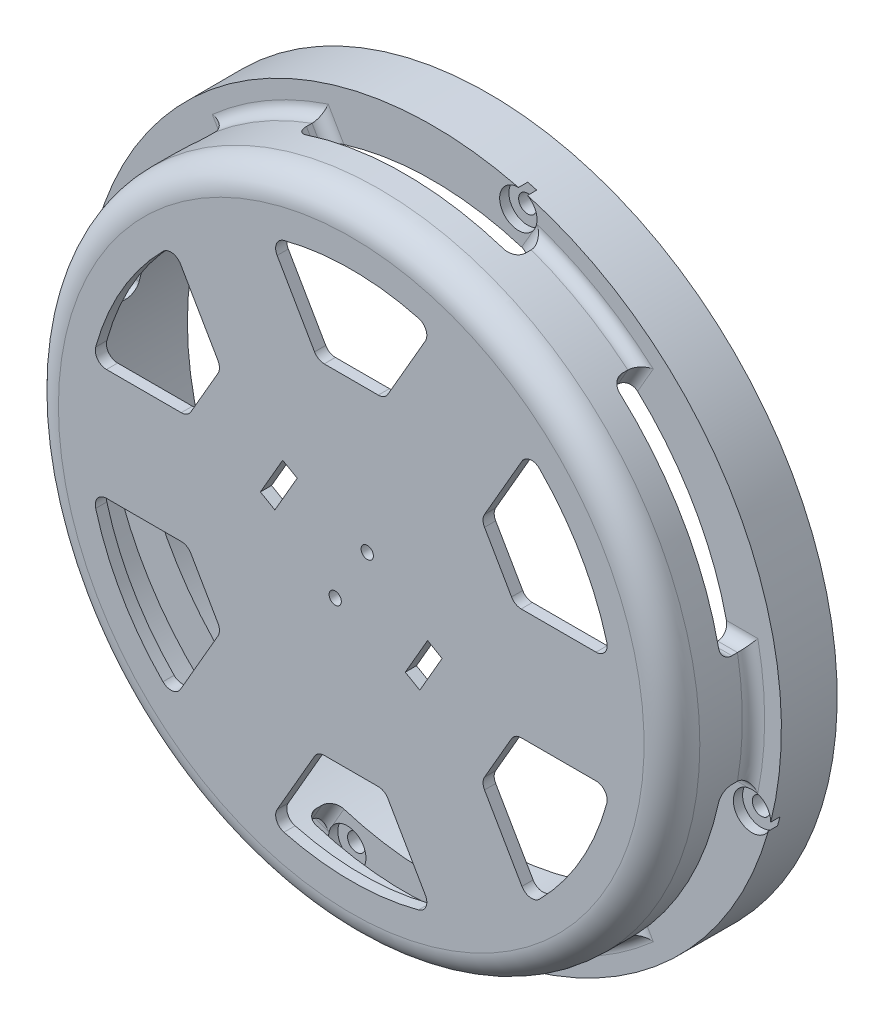
from build123d import *
from build123d.topology import SkipClean

# Parameters (mm, degrees)
SKETCH1_R                      = 62.5
SKETCH1_R_2                    = 54
BOSS_EXTRUDE1_DEPTH            = 10
SKETCH13_R                     = 1.1
CUT_EXTRUDE4_DEPTH             = 2
CUT_EXTRUDE5_REACH             = 153.648
CUT_EXTRUDE5_END_RADIUS        = 54
SKETCH14_W                     = 5
SKETCH14_H                     = 10
CUT_EXTRUDE8_START             = -14.625
CUT_EXTRUDE8_DEPTH             = 5
CBORE_FOR_M3_SBHCS1_AT_2_COUNT = 2
CBORE_FOR_M3_SBHCS1_AT_2_PITCH = 83.792153571
CBORE_FOR_M3_SBHCS1_AT_3_COUNT = 2
CBORE_FOR_M3_SBHCS1_AT_3_PITCH = 118.5
CBORE_FOR_M3_SBHCS1_AT_4_COUNT = 2
CBORE_FOR_M3_SBHCS1_AT_4_PITCH = 83.792153571
SKETCH18_R                     = 1.6
CUT_EXTRUDE7_DEPTH             = 5
CUT_EXTRUDE9_REACH             = 93.755
FILLET1_R                      = 2
FILLET2_R                      = 2
FILLET3_R                      = 2


with BuildPart() as part:
    # Sketch1 → Boss-Extrude1 (new body)
    with BuildSketch(Plane.XY):
        Circle(SKETCH1_R)
        Circle(SKETCH1_R_2, mode=Mode.SUBTRACT)
    extrude(amount=BOSS_EXTRUDE1_DEPTH)

    # Sketch19 → Revolve2 (revolve)
    with SkipClean():  # the faces are left unmerged after this step: merging them gives an invalid solid
        with BuildSketch(Plane(origin=(0, 0, 0), x_dir=(0, 0, -1), z_dir=(1, 0, 0)), mode=Mode.PRIVATE) as revolve2_sk:
            with BuildLine():
                Line((-10, 57.5), (-10, 54))
                Line((-10, 54), (-19.625, 54))
                ThreePointArc((-19.625, 54), (-21.746320344, 53.121320344), (-22.625, 51))
                Line((-22.625, 51), (-22.625, 0))
                Line((-22.625, 0), (-24.625, 0))
                Line((-24.625, 0), (-24.625, 52.5))
                ThreePointArc((-24.625, 52.5), (-23.160533906, 56.035533906), (-19.625, 57.5))
                Line((-19.625, 57.5), (-10, 57.5))
            make_face()
        revolve(revolve2_sk.sketch.rotate(Axis((0, 0, 0), (0, 0, 1)), 90), axis=Axis((0, 0, 0), (0, 0, 1)))
    add(part.part.scale(1), mode=Mode.REPLACE)  # the faces are merged on a copy

    # Sketch13 → Cut-Extrude4 (cut)
    with BuildSketch(Plane.XY.offset(24.625)):
        with Locations((-2.875, -4.979646072)):
            Circle(SKETCH13_R)
        with Locations((2.875, 4.979646072)):
            Circle(SKETCH13_R)
        Polygon((-16.289419162, 4.785898385), (-12.289419162, 11.714101615), (-9.691342951, 10.214101615), (-13.691342951, 3.285898385), align=None)
        Polygon((9.691342951, -10.214101615), (13.691342951, -3.285898385), (16.289419162, -4.785898385), (12.289419162, -11.714101615), align=None)
    extrude(amount=-CUT_EXTRUDE4_DEPTH, mode=Mode.SUBTRACT)

    # Cut-Extrude5: up to this cylinder (the profile starts outside it)
    cut_extrude5_end = Plane(origin=(0, 0, 2.5), z_dir=(0, 0, -1)) * Cylinder(CUT_EXTRUDE5_END_RADIUS, 416.296, mode=Mode.PRIVATE)
    # Sketch14 → Cut-Extrude5 (cut, up to the surface)
    with BuildSketch(Plane(origin=(-54.126587737, -31.25, 0), x_dir=(0, 0, -1), z_dir=(-0.8660254037844378, -0.5000000000000012, 0)), mode=Mode.PRIVATE) as cut_extrude5_sk1:
        with Locations((-2.5, 0)):
            Rectangle(SKETCH14_W, SKETCH14_H)
    cut_extrude5_tool1 = extrude(cut_extrude5_sk1.sketch, amount=-CUT_EXTRUDE5_REACH, mode=Mode.PRIVATE) - cut_extrude5_end
    add(cut_extrude5_tool1.solids().sort_by_distance((-54.126588, -31.25, 2.5))[0], mode=Mode.SUBTRACT)

    # Sketch20 → Cut-Extrude8 (cut)
    with BuildSketch(Plane.XY.offset(24.625).offset(CUT_EXTRUDE8_START)):
        Polygon((42.320508076, 53.301270189), (23.320508076, 20.392304845), (29.320508076, 10), (67.320508076, 10), align=None)
        Polygon((42.320508076, -53.301270189), (67.320508076, -10), (29.320508076, -10), (23.320508076, -20.392304845), align=None)
        Polygon((-25, -63.301270189), (25, -63.301270189), (6, -30.392304845), (-6, -30.392304845), align=None)
        Polygon((-67.320508076, -10), (-42.320508076, -53.301270189), (-23.320508076, -20.392304845), (-29.320508076, -10), align=None)
        Polygon((-42.320508076, 53.301270189), (-67.320508076, 10), (-29.320508076, 10), (-23.320508076, 20.392304845), align=None)
        Polygon((25, 63.301270189), (-25, 63.301270189), (-6, 30.392304845), (6, 30.392304845), align=None)
    extrude(amount=CUT_EXTRUDE8_DEPTH, mode=Mode.SUBTRACT)

    # Sketch17 → CBORE for M3 SBHCS1 (revolve, cut)
    with BuildSketch(Plane(origin=(15.335028422, 57.231105208, 10), x_dir=(0, -1, 0), z_dir=(1, 0, 0))):
        Polygon((0, 0), (0, 10), (1.6, 10), (1.6, 1.65), (3.35, 1.65), (3.35, 0), align=None)
    cbore_for_m3_sbhcs1 = revolve(axis=Axis((15.335028422, 57.231105208, 16.35), (0, 0, -1)), mode=Mode.SUBTRACT)

    # CBORE for M3 SBHCS1 at 2: CBORE for M3 SBHCS1 ×2
    with Locations(*[Vector(0.5000000000000046, -0.866025403784436, 0) * (i * CBORE_FOR_M3_SBHCS1_AT_2_PITCH) for i in range(1, CBORE_FOR_M3_SBHCS1_AT_2_COUNT)]):
        add(cbore_for_m3_sbhcs1, mode=Mode.SUBTRACT)

    # CBORE for M3 SBHCS1 at 3: CBORE for M3 SBHCS1 ×2
    with Locations(*[Vector(-0.258819045102516, -0.9659258262890695, 0) * (i * CBORE_FOR_M3_SBHCS1_AT_3_PITCH) for i in range(1, CBORE_FOR_M3_SBHCS1_AT_3_COUNT)]):
        add(cbore_for_m3_sbhcs1, mode=Mode.SUBTRACT)

    # CBORE for M3 SBHCS1 at 4: CBORE for M3 SBHCS1 ×2
    with Locations(*[Vector(-0.8660254037844362, -0.5000000000000043, 0) * (i * CBORE_FOR_M3_SBHCS1_AT_4_PITCH) for i in range(1, CBORE_FOR_M3_SBHCS1_AT_4_COUNT)]):
        add(cbore_for_m3_sbhcs1, mode=Mode.SUBTRACT)

    # Sketch18 → Cut-Extrude7 (cut)
    with BuildSketch(Plane(origin=(0, 0, 0), x_dir=(-1, 0, 0), z_dir=(0, 0, -1))):
        with Locations((-51.312005174, 29.625)):
            Circle(SKETCH18_R)
        with Locations((29.625, 51.312005174)):
            Circle(SKETCH18_R)
        with Locations((51.312005174, -29.625)):
            Circle(SKETCH18_R)
        with Locations((-29.625, -51.312005174)):
            Circle(SKETCH18_R)
    extrude(amount=-CUT_EXTRUDE7_DEPTH, mode=Mode.SUBTRACT)

    # Sketch21 → Cut-Extrude9 (cut, up to next)
    with BuildSketch(Plane.XY.offset(24.625), mode=Mode.PRIVATE) as cut_extrude9_sk1:
        with BuildLine():
            Line((46.435439053, -10), (29.320508076, -10))
            Line((29.320508076, -10), (23.320508076, -20.392304845))
            Line((23.320508076, -20.392304845), (31.877973564, -35.214269855))
            ThreePointArc((31.877973564, -35.214269855), (41.13620668, -23.75), (46.435439053, -10))
        make_face()
    cut_extrude9_tool1 = extrude(cut_extrude9_sk1.sketch, amount=-CUT_EXTRUDE9_REACH, mode=Mode.PRIVATE) & part.part
    # Sketch21 → Cut-Extrude9 (cut, up to next)
    with BuildSketch(Plane.XY.offset(24.625), mode=Mode.PRIVATE) as cut_extrude9_sk2:
        with BuildLine():
            Line((31.877973564, 35.214269855), (23.320508076, 20.392304845))
            Line((23.320508076, 20.392304845), (29.320508076, 10))
            Line((29.320508076, 10), (46.435439053, 10))
            ThreePointArc((46.435439053, 10), (41.13620668, 23.75), (31.877973564, 35.214269855))
        make_face()
    cut_extrude9_tool2 = extrude(cut_extrude9_sk2.sketch, amount=-CUT_EXTRUDE9_REACH, mode=Mode.PRIVATE) & part.part
    # Sketch21 → Cut-Extrude9 (cut, up to next)
    with BuildSketch(Plane.XY.offset(24.625), mode=Mode.PRIVATE) as cut_extrude9_sk3:
        with BuildLine():
            Line((-14.557465488, 45.214269855), (-6, 30.392304845))
            Line((-6, 30.392304845), (6, 30.392304845))
            Line((6, 30.392304845), (14.557465488, 45.214269855))
            ThreePointArc((14.557465488, 45.214269855), (0, 47.5), (-14.557465488, 45.214269855))
        make_face()
    cut_extrude9_tool3 = extrude(cut_extrude9_sk3.sketch, amount=-CUT_EXTRUDE9_REACH, mode=Mode.PRIVATE) & part.part
    # Sketch21 → Cut-Extrude9 (cut, up to next)
    with BuildSketch(Plane.XY.offset(24.625), mode=Mode.PRIVATE) as cut_extrude9_sk4:
        with BuildLine():
            Line((-46.435439053, 10), (-29.320508076, 10))
            Line((-29.320508076, 10), (-23.320508076, 20.392304845))
            Line((-23.320508076, 20.392304845), (-31.877973564, 35.214269855))
            ThreePointArc((-31.877973564, 35.214269855), (-41.13620668, 23.75), (-46.435439053, 10))
        make_face()
    cut_extrude9_tool4 = extrude(cut_extrude9_sk4.sketch, amount=-CUT_EXTRUDE9_REACH, mode=Mode.PRIVATE) & part.part
    # Sketch21 → Cut-Extrude9 (cut, up to next)
    with BuildSketch(Plane.XY.offset(24.625), mode=Mode.PRIVATE) as cut_extrude9_sk5:
        with BuildLine():
            Line((-31.877973564, -35.214269855), (-23.320508076, -20.392304845))
            Line((-23.320508076, -20.392304845), (-29.320508076, -10))
            Line((-29.320508076, -10), (-46.435439053, -10))
            ThreePointArc((-46.435439053, -10), (-41.13620668, -23.75), (-31.877973564, -35.214269855))
        make_face()
    cut_extrude9_tool5 = extrude(cut_extrude9_sk5.sketch, amount=-CUT_EXTRUDE9_REACH, mode=Mode.PRIVATE) & part.part
    # Sketch21 → Cut-Extrude9 (cut, up to next)
    with BuildSketch(Plane.XY.offset(24.625), mode=Mode.PRIVATE) as cut_extrude9_sk6:
        with BuildLine():
            Line((14.557465488, -45.214269855), (6, -30.392304845))
            Line((6, -30.392304845), (-6, -30.392304845))
            Line((-6, -30.392304845), (-14.557465488, -45.214269855))
            ThreePointArc((-14.557465488, -45.214269855), (0, -47.5), (14.557465488, -45.214269855))
        make_face()
    cut_extrude9_tool6 = extrude(cut_extrude9_sk6.sketch, amount=-CUT_EXTRUDE9_REACH, mode=Mode.PRIVATE) & part.part
    add(cut_extrude9_tool1.solids().sort_by_distance((34.435994, -19.88163, 24.625))[0], mode=Mode.SUBTRACT)
    add(cut_extrude9_tool2.solids().sort_by_distance((34.435994, 19.88163, 24.625))[0], mode=Mode.SUBTRACT)
    add(cut_extrude9_tool3.solids().sort_by_distance((0, 39.76326, 24.625))[0], mode=Mode.SUBTRACT)
    add(cut_extrude9_tool4.solids().sort_by_distance((-34.435994, 19.88163, 24.625))[0], mode=Mode.SUBTRACT)
    add(cut_extrude9_tool5.solids().sort_by_distance((-34.435994, -19.88163, 24.625))[0], mode=Mode.SUBTRACT)
    add(cut_extrude9_tool6.solids().sort_by_distance((0, -39.76326, 24.625))[0], mode=Mode.SUBTRACT)

    # Fillet1
    # the kernel refuses this fillet: 2 mm, written as the material it adds along each edge
    with BuildSketch(Plane(origin=(-32.693252361, 36.626374153, 10), x_dir=(-0.866025403784439, -0.49999999999999933, 0), z_dir=(-0.49999999999999933, 0.866025403784439, 0))) as fillet1_piece_1_section:
        with BuildLine():
            CenterArc((FILLET1_R, FILLET1_R), FILLET1_R, 180, 90)
            Line((0, FILLET1_R), (0, 0))
            Line((0, 0), (FILLET1_R, 0))
        make_face()
    fillet1_piece_1 = extrude(amount=13.557761619, mode=Mode.PRIVATE)
    fillet1_piece_1 = fillet1_piece_1 - Plane(origin=(0, 0, 10), x_dir=(1, 0, 0), z_dir=(0, 0, -1)) * Cylinder(54, 36, mode=Mode.PRIVATE)
    fillet1_piece_1 = fillet1_piece_1 & Plane(origin=(0, 0, 10), x_dir=(-1, 0, 0), z_dir=(0, 0, -1)) * Cylinder(57.5, 36, mode=Mode.PRIVATE)
    with BuildSketch(Plane(origin=(-61.623758265, 10, 10), x_dir=(0, 1, 0), z_dir=(1, 0, 0))) as fillet1_piece_2_section:
        with BuildLine():
            CenterArc((FILLET1_R, FILLET1_R), FILLET1_R, 180, 90)
            Line((0, FILLET1_R), (0, 0))
            Line((0, 0), (FILLET1_R, 0))
        make_face()
    fillet1_piece_2 = extrude(amount=13.557761619, mode=Mode.PRIVATE)
    fillet1_piece_2 = fillet1_piece_2 - Plane(origin=(0, 0, 10), x_dir=(1, 0, 0), z_dir=(0, 0, -1)) * Cylinder(54, 36, mode=Mode.PRIVATE)
    fillet1_piece_2 = fillet1_piece_2 & Plane(origin=(0, 0, 10), x_dir=(-1, 0, 0), z_dir=(0, 0, -1)) * Cylinder(57.5, 36, mode=Mode.PRIVATE)
    with BuildSketch(Plane(origin=(-32.693252361, 36.626374153, 15), x_dir=(0, 0, -1), z_dir=(-0.49999999999999933, 0.866025403784439, 0))) as fillet1_piece_3_section:
        with BuildLine():
            CenterArc((FILLET1_R, FILLET1_R), FILLET1_R, 180, 90)
            Line((0, FILLET1_R), (0, 0))
            Line((0, 0), (FILLET1_R, 0))
        make_face()
    fillet1_piece_3 = extrude(amount=13.557761619, mode=Mode.PRIVATE)
    fillet1_piece_3 = fillet1_piece_3 & Plane(origin=(0, 0, 15), x_dir=(-1, 0, 0), z_dir=(0, 0, -1)) * Cylinder(57.5, 36, mode=Mode.PRIVATE)
    fillet1_piece_3 = fillet1_piece_3 - Plane(origin=(0, 0, 15), x_dir=(-1, 0, 0), z_dir=(0, 0, 1)) * Cylinder(54, 36, mode=Mode.PRIVATE)
    with BuildSketch(Plane(origin=(-61.623758265, 10, 15), x_dir=(0, 0, -1), z_dir=(1, 0, 0))) as fillet1_piece_4_section:
        with BuildLine():
            CenterArc((FILLET1_R, FILLET1_R), FILLET1_R, 180, 90)
            Line((0, FILLET1_R), (0, 0))
            Line((0, 0), (FILLET1_R, 0))
        make_face()
    fillet1_piece_4 = extrude(amount=13.557761619, mode=Mode.PRIVATE)
    fillet1_piece_4 = fillet1_piece_4 & Plane(origin=(0, 0, 15), x_dir=(-1, 0, 0), z_dir=(0, 0, -1)) * Cylinder(57.5, 36, mode=Mode.PRIVATE)
    fillet1_piece_4 = fillet1_piece_4 - Plane(origin=(0, 0, 15), x_dir=(-1, 0, 0), z_dir=(0, 0, 1)) * Cylinder(54, 36, mode=Mode.PRIVATE)
    with BuildSketch(Plane(origin=(-48.065996646, -10, 10), x_dir=(0, -1, 0), z_dir=(-1, 0, 0))) as fillet1_piece_5_section:
        with BuildLine():
            CenterArc((FILLET1_R, FILLET1_R), FILLET1_R, 180, 90)
            Line((0, FILLET1_R), (0, 0))
            Line((0, 0), (FILLET1_R, 0))
        make_face()
    fillet1_piece_5 = extrude(amount=13.557761619, mode=Mode.PRIVATE)
    fillet1_piece_5 = fillet1_piece_5 - Plane(origin=(0, 0, 10), x_dir=(1, 0, 0), z_dir=(0, 0, -1)) * Cylinder(54, 36, mode=Mode.PRIVATE)
    fillet1_piece_5 = fillet1_piece_5 & Plane(origin=(0, 0, 10), x_dir=(-1, 0, 0), z_dir=(0, 0, -1)) * Cylinder(57.5, 36, mode=Mode.PRIVATE)
    with BuildSketch(Plane(origin=(-39.47213317, -48.367740134, 10), x_dir=(-0.8660254037844399, 0.4999999999999979, 0), z_dir=(0.4999999999999979, 0.8660254037844399, 0))) as fillet1_piece_6_section:
        with BuildLine():
            CenterArc((FILLET1_R, FILLET1_R), FILLET1_R, 180, 90)
            Line((0, FILLET1_R), (0, 0))
            Line((0, 0), (FILLET1_R, 0))
        make_face()
    fillet1_piece_6 = extrude(amount=13.557761619, mode=Mode.PRIVATE)
    fillet1_piece_6 = fillet1_piece_6 - Plane(origin=(0, 0, 10), x_dir=(1, 0, 0), z_dir=(0, 0, -1)) * Cylinder(54, 36, mode=Mode.PRIVATE)
    fillet1_piece_6 = fillet1_piece_6 & Plane(origin=(0, 0, 10), x_dir=(-1, 0, 0), z_dir=(0, 0, -1)) * Cylinder(57.5, 36, mode=Mode.PRIVATE)
    with BuildSketch(Plane(origin=(-48.065996646, -10, 15), x_dir=(0, 0, -1), z_dir=(-1, 0, 0))) as fillet1_piece_7_section:
        with BuildLine():
            CenterArc((FILLET1_R, FILLET1_R), FILLET1_R, 180, 90)
            Line((0, FILLET1_R), (0, 0))
            Line((0, 0), (FILLET1_R, 0))
        make_face()
    fillet1_piece_7 = extrude(amount=13.557761619, mode=Mode.PRIVATE)
    fillet1_piece_7 = fillet1_piece_7 & Plane(origin=(0, 0, 15), x_dir=(-1, 0, 0), z_dir=(0, 0, -1)) * Cylinder(57.5, 36, mode=Mode.PRIVATE)
    fillet1_piece_7 = fillet1_piece_7 - Plane(origin=(0, 0, 15), x_dir=(-1, 0, 0), z_dir=(0, 0, 1)) * Cylinder(54, 36, mode=Mode.PRIVATE)
    with BuildSketch(Plane(origin=(-39.47213317, -48.367740134, 15), x_dir=(0, 0, -1), z_dir=(0.4999999999999979, 0.8660254037844399, 0))) as fillet1_piece_8_section:
        with BuildLine():
            CenterArc((FILLET1_R, FILLET1_R), FILLET1_R, 180, 90)
            Line((0, FILLET1_R), (0, 0))
            Line((0, 0), (FILLET1_R, 0))
        make_face()
    fillet1_piece_8 = extrude(amount=13.557761619, mode=Mode.PRIVATE)
    fillet1_piece_8 = fillet1_piece_8 & Plane(origin=(0, 0, 15), x_dir=(-1, 0, 0), z_dir=(0, 0, -1)) * Cylinder(57.5, 36, mode=Mode.PRIVATE)
    fillet1_piece_8 = fillet1_piece_8 - Plane(origin=(0, 0, 15), x_dir=(-1, 0, 0), z_dir=(0, 0, 1)) * Cylinder(54, 36, mode=Mode.PRIVATE)
    with BuildSketch(Plane(origin=(32.693252361, -36.626374153, 10), x_dir=(0.8660254037844393, 0.4999999999999989, 0), z_dir=(0.4999999999999989, -0.8660254037844394, 0))) as fillet1_piece_9_section:
        with BuildLine():
            CenterArc((FILLET1_R, FILLET1_R), FILLET1_R, 180, 90)
            Line((0, FILLET1_R), (0, 0))
            Line((0, 0), (FILLET1_R, 0))
        make_face()
    fillet1_piece_9 = extrude(amount=13.557761619, mode=Mode.PRIVATE)
    fillet1_piece_9 = fillet1_piece_9 - Plane(origin=(0, 0, 10), x_dir=(1, 0, 0), z_dir=(0, 0, -1)) * Cylinder(54, 36, mode=Mode.PRIVATE)
    fillet1_piece_9 = fillet1_piece_9 & Plane(origin=(0, 0, 10), x_dir=(-1, 0, 0), z_dir=(0, 0, -1)) * Cylinder(57.5, 36, mode=Mode.PRIVATE)
    with BuildSketch(Plane(origin=(61.623758265, -10, 10), x_dir=(0, -1, 0), z_dir=(-1, 0, 0))) as fillet1_piece_10_section:
        with BuildLine():
            CenterArc((FILLET1_R, FILLET1_R), FILLET1_R, 180, 90)
            Line((0, FILLET1_R), (0, 0))
            Line((0, 0), (FILLET1_R, 0))
        make_face()
    fillet1_piece_10 = extrude(amount=13.557761619, mode=Mode.PRIVATE)
    fillet1_piece_10 = fillet1_piece_10 - Plane(origin=(0, 0, 10), x_dir=(1, 0, 0), z_dir=(0, 0, -1)) * Cylinder(54, 36, mode=Mode.PRIVATE)
    fillet1_piece_10 = fillet1_piece_10 & Plane(origin=(0, 0, 10), x_dir=(-1, 0, 0), z_dir=(0, 0, -1)) * Cylinder(57.5, 36, mode=Mode.PRIVATE)
    with BuildSketch(Plane(origin=(32.693252361, -36.626374153, 15), x_dir=(0, 0, -1), z_dir=(0.4999999999999989, -0.8660254037844394, 0))) as fillet1_piece_11_section:
        with BuildLine():
            CenterArc((FILLET1_R, FILLET1_R), FILLET1_R, 180, 90)
            Line((0, FILLET1_R), (0, 0))
            Line((0, 0), (FILLET1_R, 0))
        make_face()
    fillet1_piece_11 = extrude(amount=13.557761619, mode=Mode.PRIVATE)
    fillet1_piece_11 = fillet1_piece_11 & Plane(origin=(0, 0, 15), x_dir=(-1, 0, 0), z_dir=(0, 0, -1)) * Cylinder(57.5, 36, mode=Mode.PRIVATE)
    fillet1_piece_11 = fillet1_piece_11 - Plane(origin=(0, 0, 15), x_dir=(-1, 0, 0), z_dir=(0, 0, 1)) * Cylinder(54, 36, mode=Mode.PRIVATE)
    with BuildSketch(Plane(origin=(61.623758265, -10, 15), x_dir=(0, 0, -1), z_dir=(-1, 0, 0))) as fillet1_piece_12_section:
        with BuildLine():
            CenterArc((FILLET1_R, FILLET1_R), FILLET1_R, 180, 90)
            Line((0, FILLET1_R), (0, 0))
            Line((0, 0), (FILLET1_R, 0))
        make_face()
    fillet1_piece_12 = extrude(amount=13.557761619, mode=Mode.PRIVATE)
    fillet1_piece_12 = fillet1_piece_12 & Plane(origin=(0, 0, 15), x_dir=(-1, 0, 0), z_dir=(0, 0, -1)) * Cylinder(57.5, 36, mode=Mode.PRIVATE)
    fillet1_piece_12 = fillet1_piece_12 - Plane(origin=(0, 0, 15), x_dir=(-1, 0, 0), z_dir=(0, 0, 1)) * Cylinder(54, 36, mode=Mode.PRIVATE)
    with BuildSketch(Plane(origin=(-15.372744285, -46.626374153, 10), x_dir=(0.8660254037844383, -0.5000000000000009, 0), z_dir=(-0.5000000000000009, -0.8660254037844383, 0))) as fillet1_piece_13_section:
        with BuildLine():
            CenterArc((FILLET1_R, FILLET1_R), FILLET1_R, 180, 90)
            Line((0, FILLET1_R), (0, 0))
            Line((0, 0), (FILLET1_R, 0))
        make_face()
    fillet1_piece_13 = extrude(amount=13.557761619, mode=Mode.PRIVATE)
    fillet1_piece_13 = fillet1_piece_13 - Plane(origin=(0, 0, 10), x_dir=(1, 0, 0), z_dir=(0, 0, -1)) * Cylinder(54, 36, mode=Mode.PRIVATE)
    fillet1_piece_13 = fillet1_piece_13 & Plane(origin=(0, 0, 10), x_dir=(-1, 0, 0), z_dir=(0, 0, -1)) * Cylinder(57.5, 36, mode=Mode.PRIVATE)
    with BuildSketch(Plane(origin=(22.151625094, -58.367740134, 10), x_dir=(-0.8660254037844373, -0.5000000000000022, 0), z_dir=(-0.5000000000000023, 0.8660254037844374, 0))) as fillet1_piece_14_section:
        with BuildLine():
            CenterArc((FILLET1_R, FILLET1_R), FILLET1_R, 180, 90)
            Line((0, FILLET1_R), (0, 0))
            Line((0, 0), (FILLET1_R, 0))
        make_face()
    fillet1_piece_14 = extrude(amount=13.557761619, mode=Mode.PRIVATE)
    fillet1_piece_14 = fillet1_piece_14 - Plane(origin=(0, 0, 10), x_dir=(1, 0, 0), z_dir=(0, 0, -1)) * Cylinder(54, 36, mode=Mode.PRIVATE)
    fillet1_piece_14 = fillet1_piece_14 & Plane(origin=(0, 0, 10), x_dir=(-1, 0, 0), z_dir=(0, 0, -1)) * Cylinder(57.5, 36, mode=Mode.PRIVATE)
    with BuildSketch(Plane(origin=(-15.372744285, -46.626374153, 15), x_dir=(0, 0, -1), z_dir=(-0.5000000000000009, -0.8660254037844383, 0))) as fillet1_piece_15_section:
        with BuildLine():
            CenterArc((FILLET1_R, FILLET1_R), FILLET1_R, 180, 90)
            Line((0, FILLET1_R), (0, 0))
            Line((0, 0), (FILLET1_R, 0))
        make_face()
    fillet1_piece_15 = extrude(amount=13.557761619, mode=Mode.PRIVATE)
    fillet1_piece_15 = fillet1_piece_15 & Plane(origin=(0, 0, 15), x_dir=(-1, 0, 0), z_dir=(0, 0, -1)) * Cylinder(57.5, 36, mode=Mode.PRIVATE)
    fillet1_piece_15 = fillet1_piece_15 - Plane(origin=(0, 0, 15), x_dir=(-1, 0, 0), z_dir=(0, 0, 1)) * Cylinder(54, 36, mode=Mode.PRIVATE)
    with BuildSketch(Plane(origin=(22.151625094, -58.367740134, 15), x_dir=(0, 0, -1), z_dir=(-0.5000000000000023, 0.8660254037844374, 0))) as fillet1_piece_16_section:
        with BuildLine():
            CenterArc((FILLET1_R, FILLET1_R), FILLET1_R, 180, 90)
            Line((0, FILLET1_R), (0, 0))
            Line((0, 0), (FILLET1_R, 0))
        make_face()
    fillet1_piece_16 = extrude(amount=13.557761619, mode=Mode.PRIVATE)
    fillet1_piece_16 = fillet1_piece_16 & Plane(origin=(0, 0, 15), x_dir=(-1, 0, 0), z_dir=(0, 0, -1)) * Cylinder(57.5, 36, mode=Mode.PRIVATE)
    fillet1_piece_16 = fillet1_piece_16 - Plane(origin=(0, 0, 15), x_dir=(-1, 0, 0), z_dir=(0, 0, 1)) * Cylinder(54, 36, mode=Mode.PRIVATE)
    with BuildSketch(Plane(origin=(15.372744285, 46.626374153, 10), x_dir=(-0.8660254037844384, 0.5000000000000004, 0), z_dir=(0.5000000000000004, 0.8660254037844384, 0))) as fillet1_piece_17_section:
        with BuildLine():
            CenterArc((FILLET1_R, FILLET1_R), FILLET1_R, 180, 90)
            Line((0, FILLET1_R), (0, 0))
            Line((0, 0), (FILLET1_R, 0))
        make_face()
    fillet1_piece_17 = extrude(amount=13.557761619, mode=Mode.PRIVATE)
    fillet1_piece_17 = fillet1_piece_17 - Plane(origin=(0, 0, 10), x_dir=(1, 0, 0), z_dir=(0, 0, -1)) * Cylinder(54, 36, mode=Mode.PRIVATE)
    fillet1_piece_17 = fillet1_piece_17 & Plane(origin=(0, 0, 10), x_dir=(-1, 0, 0), z_dir=(0, 0, -1)) * Cylinder(57.5, 36, mode=Mode.PRIVATE)
    with BuildSketch(Plane(origin=(-22.151625094, 58.367740134, 10), x_dir=(0.8660254037844373, 0.5000000000000027, 0), z_dir=(0.5000000000000027, -0.8660254037844372, 0))) as fillet1_piece_18_section:
        with BuildLine():
            CenterArc((FILLET1_R, FILLET1_R), FILLET1_R, 180, 90)
            Line((0, FILLET1_R), (0, 0))
            Line((0, 0), (FILLET1_R, 0))
        make_face()
    fillet1_piece_18 = extrude(amount=13.557761619, mode=Mode.PRIVATE)
    fillet1_piece_18 = fillet1_piece_18 - Plane(origin=(0, 0, 10), x_dir=(1, 0, 0), z_dir=(0, 0, -1)) * Cylinder(54, 36, mode=Mode.PRIVATE)
    fillet1_piece_18 = fillet1_piece_18 & Plane(origin=(0, 0, 10), x_dir=(-1, 0, 0), z_dir=(0, 0, -1)) * Cylinder(57.5, 36, mode=Mode.PRIVATE)
    with BuildSketch(Plane(origin=(15.372744285, 46.626374153, 15), x_dir=(0, 0, -1), z_dir=(0.5000000000000004, 0.8660254037844384, 0))) as fillet1_piece_19_section:
        with BuildLine():
            CenterArc((FILLET1_R, FILLET1_R), FILLET1_R, 180, 90)
            Line((0, FILLET1_R), (0, 0))
            Line((0, 0), (FILLET1_R, 0))
        make_face()
    fillet1_piece_19 = extrude(amount=13.557761619, mode=Mode.PRIVATE)
    fillet1_piece_19 = fillet1_piece_19 & Plane(origin=(0, 0, 15), x_dir=(-1, 0, 0), z_dir=(0, 0, -1)) * Cylinder(57.5, 36, mode=Mode.PRIVATE)
    fillet1_piece_19 = fillet1_piece_19 - Plane(origin=(0, 0, 15), x_dir=(-1, 0, 0), z_dir=(0, 0, 1)) * Cylinder(54, 36, mode=Mode.PRIVATE)
    with BuildSketch(Plane(origin=(-22.151625094, 58.367740134, 15), x_dir=(0, 0, -1), z_dir=(0.5000000000000027, -0.8660254037844372, 0))) as fillet1_piece_20_section:
        with BuildLine():
            CenterArc((FILLET1_R, FILLET1_R), FILLET1_R, 180, 90)
            Line((0, FILLET1_R), (0, 0))
            Line((0, 0), (FILLET1_R, 0))
        make_face()
    fillet1_piece_20 = extrude(amount=13.557761619, mode=Mode.PRIVATE)
    fillet1_piece_20 = fillet1_piece_20 & Plane(origin=(0, 0, 15), x_dir=(-1, 0, 0), z_dir=(0, 0, -1)) * Cylinder(57.5, 36, mode=Mode.PRIVATE)
    fillet1_piece_20 = fillet1_piece_20 - Plane(origin=(0, 0, 15), x_dir=(-1, 0, 0), z_dir=(0, 0, 1)) * Cylinder(54, 36, mode=Mode.PRIVATE)
    with BuildSketch(Plane(origin=(48.065996646, 10, 10), x_dir=(0, 1, 0), z_dir=(1, 0, 0))) as fillet1_piece_21_section:
        with BuildLine():
            CenterArc((FILLET1_R, FILLET1_R), FILLET1_R, 180, 90)
            Line((0, FILLET1_R), (0, 0))
            Line((0, 0), (FILLET1_R, 0))
        make_face()
    fillet1_piece_21 = extrude(amount=13.557761619, mode=Mode.PRIVATE)
    fillet1_piece_21 = fillet1_piece_21 - Plane(origin=(0, 0, 10), x_dir=(1, 0, 0), z_dir=(0, 0, -1)) * Cylinder(54, 36, mode=Mode.PRIVATE)
    fillet1_piece_21 = fillet1_piece_21 & Plane(origin=(0, 0, 10), x_dir=(-1, 0, 0), z_dir=(0, 0, -1)) * Cylinder(57.5, 36, mode=Mode.PRIVATE)
    with BuildSketch(Plane(origin=(39.47213317, 48.367740134, 10), x_dir=(0.8660254037844398, -0.499999999999998, 0), z_dir=(-0.49999999999999795, -0.8660254037844398, 0))) as fillet1_piece_22_section:
        with BuildLine():
            CenterArc((FILLET1_R, FILLET1_R), FILLET1_R, 180, 90)
            Line((0, FILLET1_R), (0, 0))
            Line((0, 0), (FILLET1_R, 0))
        make_face()
    fillet1_piece_22 = extrude(amount=13.557761619, mode=Mode.PRIVATE)
    fillet1_piece_22 = fillet1_piece_22 - Plane(origin=(0, 0, 10), x_dir=(1, 0, 0), z_dir=(0, 0, -1)) * Cylinder(54, 36, mode=Mode.PRIVATE)
    fillet1_piece_22 = fillet1_piece_22 & Plane(origin=(0, 0, 10), x_dir=(-1, 0, 0), z_dir=(0, 0, -1)) * Cylinder(57.5, 36, mode=Mode.PRIVATE)
    with BuildSketch(Plane(origin=(48.065996646, 10, 15), x_dir=(0, 0, -1), z_dir=(1, 0, 0))) as fillet1_piece_23_section:
        with BuildLine():
            CenterArc((FILLET1_R, FILLET1_R), FILLET1_R, 180, 90)
            Line((0, FILLET1_R), (0, 0))
            Line((0, 0), (FILLET1_R, 0))
        make_face()
    fillet1_piece_23 = extrude(amount=13.557761619, mode=Mode.PRIVATE)
    fillet1_piece_23 = fillet1_piece_23 & Plane(origin=(0, 0, 15), x_dir=(-1, 0, 0), z_dir=(0, 0, -1)) * Cylinder(57.5, 36, mode=Mode.PRIVATE)
    fillet1_piece_23 = fillet1_piece_23 - Plane(origin=(0, 0, 15), x_dir=(-1, 0, 0), z_dir=(0, 0, 1)) * Cylinder(54, 36, mode=Mode.PRIVATE)
    with BuildSketch(Plane(origin=(39.47213317, 48.367740134, 15), x_dir=(0, 0, -1), z_dir=(-0.49999999999999795, -0.8660254037844398, 0))) as fillet1_piece_24_section:
        with BuildLine():
            CenterArc((FILLET1_R, FILLET1_R), FILLET1_R, 180, 90)
            Line((0, FILLET1_R), (0, 0))
            Line((0, 0), (FILLET1_R, 0))
        make_face()
    fillet1_piece_24 = extrude(amount=13.557761619, mode=Mode.PRIVATE)
    fillet1_piece_24 = fillet1_piece_24 & Plane(origin=(0, 0, 15), x_dir=(-1, 0, 0), z_dir=(0, 0, -1)) * Cylinder(57.5, 36, mode=Mode.PRIVATE)
    fillet1_piece_24 = fillet1_piece_24 - Plane(origin=(0, 0, 15), x_dir=(-1, 0, 0), z_dir=(0, 0, 1)) * Cylinder(54, 36, mode=Mode.PRIVATE)
    with BuildSketch(Plane(origin=(0, 0, 10), x_dir=(0.7070790246972205, 0.7071345365863752, 0), z_dir=(0.7071345365863752, -0.7070790246972205, 0))) as fillet1_piece_25_section:
        with BuildLine():
            CenterArc((57.5 + FILLET1_R, FILLET1_R), FILLET1_R, 180, 90)
            Line((57.5, FILLET1_R), (57.5, 0))
            Line((57.5, 0), (57.5 + FILLET1_R, 0))
        make_face()
    fillet1_piece_25 = revolve(axis=Axis((0, 0, 10), (0, 0, 1)), revolution_arc=29.995501957, mode=Mode.PRIVATE)
    fillet1_piece_25 = split(fillet1_piece_25, bisect_by=Plane(origin=(8.660254038, -5, 10), z_dir=(-0.8660254037844398, 0.49999999999999795, 0)), keep=Keep.TOP, mode=Mode.PRIVATE)
    fillet1_piece_25 = split(fillet1_piece_25, bisect_by=Plane(origin=(-8.660254038, 5, 10), z_dir=(0.8660254037844384, -0.5000000000000004, 0)), keep=Keep.TOP, mode=Mode.PRIVATE)
    with BuildSketch(Plane(origin=(0, 0, 10), x_dir=(-0.2588569602285776, 0.9659156661640914, 0), z_dir=(0.9659156661640914, 0.2588569602285776, 0))) as fillet1_piece_26_section:
        with BuildLine():
            CenterArc((57.5 + FILLET1_R, FILLET1_R), FILLET1_R, 180, 90)
            Line((57.5, FILLET1_R), (57.5, 0))
            Line((57.5, 0), (57.5 + FILLET1_R, 0))
        make_face()
    fillet1_piece_26 = revolve(axis=Axis((0, 0, 10), (0, 0, 1)), revolution_arc=29.995501957, mode=Mode.PRIVATE)
    fillet1_piece_26 = split(fillet1_piece_26, bisect_by=Plane(origin=(8.660254038, 5, 10), z_dir=(-0.8660254037844372, -0.5000000000000027, 0)), keep=Keep.TOP, mode=Mode.PRIVATE)
    fillet1_piece_26 = split(fillet1_piece_26, bisect_by=Plane(origin=(-8.660254038, -5, 10), z_dir=(0.866025403784439, 0.49999999999999933, 0)), keep=Keep.TOP, mode=Mode.PRIVATE)
    with BuildSketch(Plane(origin=(0, 0, 10), x_dir=(-1, 0, 0), z_dir=(0, 1, 0))) as fillet1_piece_27_section:
        with BuildLine():
            CenterArc((57.5 + FILLET1_R, FILLET1_R), FILLET1_R, 180, 90)
            Line((57.5, FILLET1_R), (57.5, 0))
            Line((57.5, 0), (57.5 + FILLET1_R, 0))
        make_face()
    fillet1_piece_27 = revolve(axis=Axis((0, 0, 10), (0, 0, 1)), revolution_arc=14.997676643, mode=Mode.PRIVATE)
    fillet1_piece_27 = split(fillet1_piece_27, bisect_by=Plane(origin=(0, -10, 10), z_dir=(0, 1, 0)), keep=Keep.TOP, mode=Mode.PRIVATE)
    with BuildSketch(Plane(origin=(0, 0, 10), x_dir=(-0.7070790246972194, -0.7071345365863762, 0), z_dir=(-0.7071345365863762, 0.7070790246972194, 0))) as fillet1_piece_28_section:
        with BuildLine():
            CenterArc((57.5 + FILLET1_R, FILLET1_R), FILLET1_R, 180, 90)
            Line((57.5, FILLET1_R), (57.5, 0))
            Line((57.5, 0), (57.5 + FILLET1_R, 0))
        make_face()
    fillet1_piece_28 = revolve(axis=Axis((0, 0, 10), (0, 0, 1)), revolution_arc=29.995501957, mode=Mode.PRIVATE)
    fillet1_piece_28 = split(fillet1_piece_28, bisect_by=Plane(origin=(-8.660254038, 5, 10), z_dir=(0.8660254037844399, -0.4999999999999979, 0)), keep=Keep.TOP, mode=Mode.PRIVATE)
    fillet1_piece_28 = split(fillet1_piece_28, bisect_by=Plane(origin=(8.660254038, -5, 10), z_dir=(-0.8660254037844383, 0.5000000000000009, 0)), keep=Keep.TOP, mode=Mode.PRIVATE)
    with BuildSketch(Plane(origin=(0, 0, 10), x_dir=(0.2588569602285767, -0.9659156661640916, 0), z_dir=(-0.9659156661640916, -0.2588569602285767, 0))) as fillet1_piece_29_section:
        with BuildLine():
            CenterArc((57.5 + FILLET1_R, FILLET1_R), FILLET1_R, 180, 90)
            Line((57.5, FILLET1_R), (57.5, 0))
            Line((57.5, 0), (57.5 + FILLET1_R, 0))
        make_face()
    fillet1_piece_29 = revolve(axis=Axis((0, 0, 10), (0, 0, 1)), revolution_arc=29.995501957, mode=Mode.PRIVATE)
    fillet1_piece_29 = split(fillet1_piece_29, bisect_by=Plane(origin=(-8.660254038, -5, 10), z_dir=(0.8660254037844374, 0.5000000000000023, 0)), keep=Keep.TOP, mode=Mode.PRIVATE)
    fillet1_piece_29 = split(fillet1_piece_29, bisect_by=Plane(origin=(8.660254038, 5, 10), z_dir=(-0.8660254037844394, -0.4999999999999989, 0)), keep=Keep.TOP, mode=Mode.PRIVATE)
    with BuildSketch(Plane(origin=(0, 0, 10), x_dir=(0.965935984925756, -0.25878112957769894, 0), z_dir=(-0.25878112957769894, -0.965935984925756, 0))) as fillet1_piece_30_section:
        with BuildLine():
            CenterArc((57.5 + FILLET1_R, FILLET1_R), FILLET1_R, 180, 90)
            Line((57.5, FILLET1_R), (57.5, 0))
            Line((57.5, 0), (57.5 + FILLET1_R, 0))
        make_face()
    fillet1_piece_30 = revolve(axis=Axis((0, 0, 10), (0, 0, 1)), revolution_arc=29.995501957, mode=Mode.PRIVATE)
    fillet1_piece_30 = split(fillet1_piece_30, bisect_by=Plane(origin=(0, -10, 10), z_dir=(0, 1, 0)), keep=Keep.TOP, mode=Mode.PRIVATE)
    fillet1_piece_30 = split(fillet1_piece_30, bisect_by=Plane(origin=(0, 10, 10), z_dir=(0, -1, 0)), keep=Keep.TOP, mode=Mode.PRIVATE)
    with BuildSketch(Plane(origin=(0, 0, 10), x_dir=(-0.9659363206660971, 0.25877987637767114, 0), z_dir=(0.25877987637767114, 0.9659363206660971, 0))) as fillet1_piece_31_section:
        with BuildLine():
            CenterArc((57.5 + FILLET1_R, FILLET1_R), FILLET1_R, 180, 90)
            Line((57.5, FILLET1_R), (57.5, 0))
            Line((57.5, 0), (57.5 + FILLET1_R, 0))
        make_face()
    fillet1_piece_31 = revolve(axis=Axis((0, 0, 10), (0, 0, 1)), revolution_arc=14.997676643, mode=Mode.PRIVATE)
    fillet1_piece_31 = split(fillet1_piece_31, bisect_by=Plane(origin=(0, 10, 10), z_dir=(0, -1, 0)), keep=Keep.TOP, mode=Mode.PRIVATE)
    with BuildSketch(Plane(origin=(-32.693252361, 36.626374153, 10), x_dir=(-0.866025403784439, -0.49999999999999933, 0), z_dir=(-0.49999999999999933, 0.866025403784439, 0))) as fillet1_piece_32a_section:
        with BuildLine():
            CenterArc((FILLET1_R, FILLET1_R), FILLET1_R, 180, 90)
            Line((0, FILLET1_R), (0, 0))
            Line((0, 0), (FILLET1_R, 0))
        make_face()
    fillet1_piece_32a = extrude(amount=13.557761619, mode=Mode.PRIVATE)
    fillet1_piece_32a = fillet1_piece_32a & Plane(origin=(0, 0, 10), x_dir=(1, 0, 0), z_dir=(0, 0, -1)) * Cylinder(62.5, 36, mode=Mode.PRIVATE)
    fillet1_piece_32a = fillet1_piece_32a - Plane(origin=(0, 0, 10), x_dir=(-1, 0, 0), z_dir=(0, 0, -1)) * Cylinder(57.5, 36, mode=Mode.PRIVATE)
    with BuildSketch(Plane(origin=(0, 0, 10), x_dir=(-0.2588569602285776, 0.9659156661640914, 0), z_dir=(0.9659156661640914, 0.2588569602285776, 0))) as fillet1_piece_32b_section:
        with BuildLine():
            CenterArc((57.5 + FILLET1_R, FILLET1_R), FILLET1_R, 180, 90)
            Line((57.5, FILLET1_R), (57.5, 0))
            Line((57.5, 0), (57.5 + FILLET1_R, 0))
        make_face()
    fillet1_piece_32b = revolve(axis=Axis((0, 0, 10), (0, 0, 1)), revolution_arc=29.995501957, mode=Mode.PRIVATE)
    fillet1_piece_32b = split(fillet1_piece_32b, bisect_by=Plane(origin=(-8.660254038, -5, 10), z_dir=(-0.866025403784439, -0.49999999999999933, 0)), keep=Keep.TOP, mode=Mode.PRIVATE)
    fillet1_piece_32 = fillet1_piece_32a & fillet1_piece_32b
    with BuildSketch(Plane(origin=(0, 0, 10), x_dir=(-0.9659363206660971, 0.25877987637767114, 0), z_dir=(0.25877987637767114, 0.9659363206660971, 0))) as fillet1_piece_33a_section:
        with BuildLine():
            CenterArc((57.5 + FILLET1_R, FILLET1_R), FILLET1_R, 180, 90)
            Line((57.5, FILLET1_R), (57.5, 0))
            Line((57.5, 0), (57.5 + FILLET1_R, 0))
        make_face()
    fillet1_piece_33a = revolve(axis=Axis((0, 0, 10), (0, 0, 1)), revolution_arc=14.997676643, mode=Mode.PRIVATE)
    fillet1_piece_33a = fillet1_piece_33a - Plane(origin=(-57.231105208, 15.335028422, 10), x_dir=(0, -1, 0), z_dir=(0, 0, 1)) * Cylinder(3.35, 239, mode=Mode.PRIVATE)
    fillet1_piece_33a = split(fillet1_piece_33a, bisect_by=Plane(origin=(0, 10, 10), z_dir=(0, 1, 0)), keep=Keep.TOP, mode=Mode.PRIVATE)
    with BuildSketch(Plane(origin=(-61.623758265, 10, 10), x_dir=(0, 1, 0), z_dir=(1, 0, 0))) as fillet1_piece_33b_section:
        with BuildLine():
            CenterArc((FILLET1_R, FILLET1_R), FILLET1_R, 180, 90)
            Line((0, FILLET1_R), (0, 0))
            Line((0, 0), (FILLET1_R, 0))
        make_face()
    fillet1_piece_33b = extrude(amount=13.557761619, mode=Mode.PRIVATE)
    fillet1_piece_33b = fillet1_piece_33b & Plane(origin=(0, 0, 10), x_dir=(1, 0, 0), z_dir=(0, 0, -1)) * Cylinder(62.5, 36, mode=Mode.PRIVATE)
    fillet1_piece_33b = fillet1_piece_33b - Plane(origin=(-57.231105208, 15.335028422, 10), x_dir=(0, -1, 0), z_dir=(0, 0, 1)) * Cylinder(3.35, 36, mode=Mode.PRIVATE)
    fillet1_piece_33b = fillet1_piece_33b - Plane(origin=(0, 0, 10), x_dir=(-1, 0, 0), z_dir=(0, 0, -1)) * Cylinder(57.5, 36, mode=Mode.PRIVATE)
    fillet1_piece_33 = fillet1_piece_33a & fillet1_piece_33b
    with BuildSketch(Plane(origin=(-48.065996646, -10, 10), x_dir=(0, -1, 0), z_dir=(-1, 0, 0))) as fillet1_piece_34a_section:
        with BuildLine():
            CenterArc((FILLET1_R, FILLET1_R), FILLET1_R, 180, 90)
            Line((0, FILLET1_R), (0, 0))
            Line((0, 0), (FILLET1_R, 0))
        make_face()
    fillet1_piece_34a = extrude(amount=13.557761619, mode=Mode.PRIVATE)
    fillet1_piece_34a = fillet1_piece_34a & Plane(origin=(0, 0, 10), x_dir=(1, 0, 0), z_dir=(0, 0, -1)) * Cylinder(62.5, 36, mode=Mode.PRIVATE)
    fillet1_piece_34a = fillet1_piece_34a - Plane(origin=(0, 0, 10), x_dir=(-1, 0, 0), z_dir=(0, 0, -1)) * Cylinder(57.5, 36, mode=Mode.PRIVATE)
    with BuildSketch(Plane(origin=(0, 0, 10), x_dir=(-1, 0, 0), z_dir=(0, 1, 0))) as fillet1_piece_34b_section:
        with BuildLine():
            CenterArc((57.5 + FILLET1_R, FILLET1_R), FILLET1_R, 180, 90)
            Line((57.5, FILLET1_R), (57.5, 0))
            Line((57.5, 0), (57.5 + FILLET1_R, 0))
        make_face()
    fillet1_piece_34b = revolve(axis=Axis((0, 0, 10), (0, 0, 1)), revolution_arc=14.997676643, mode=Mode.PRIVATE)
    fillet1_piece_34b = split(fillet1_piece_34b, bisect_by=Plane(origin=(0, -10, 10), z_dir=(0, -1, 0)), keep=Keep.TOP, mode=Mode.PRIVATE)
    fillet1_piece_34 = fillet1_piece_34a & fillet1_piece_34b
    with BuildSketch(Plane(origin=(0, 0, 10), x_dir=(-0.7070790246972194, -0.7071345365863762, 0), z_dir=(-0.7071345365863762, 0.7070790246972194, 0))) as fillet1_piece_35a_section:
        with BuildLine():
            CenterArc((57.5 + FILLET1_R, FILLET1_R), FILLET1_R, 180, 90)
            Line((57.5, FILLET1_R), (57.5, 0))
            Line((57.5, 0), (57.5 + FILLET1_R, 0))
        make_face()
    fillet1_piece_35a = revolve(axis=Axis((0, 0, 10), (0, 0, 1)), revolution_arc=29.995501957, mode=Mode.PRIVATE)
    fillet1_piece_35a = split(fillet1_piece_35a, bisect_by=Plane(origin=(-8.660254038, 5, 10), z_dir=(-0.8660254037844399, 0.4999999999999979, 0)), keep=Keep.TOP, mode=Mode.PRIVATE)
    with BuildSketch(Plane(origin=(-39.47213317, -48.367740134, 10), x_dir=(-0.8660254037844399, 0.4999999999999979, 0), z_dir=(0.4999999999999979, 0.8660254037844399, 0))) as fillet1_piece_35b_section:
        with BuildLine():
            CenterArc((FILLET1_R, FILLET1_R), FILLET1_R, 180, 90)
            Line((0, FILLET1_R), (0, 0))
            Line((0, 0), (FILLET1_R, 0))
        make_face()
    fillet1_piece_35b = extrude(amount=13.557761619, mode=Mode.PRIVATE)
    fillet1_piece_35b = fillet1_piece_35b & Plane(origin=(0, 0, 10), x_dir=(1, 0, 0), z_dir=(0, 0, -1)) * Cylinder(62.5, 36, mode=Mode.PRIVATE)
    fillet1_piece_35b = fillet1_piece_35b - Plane(origin=(0, 0, 10), x_dir=(-1, 0, 0), z_dir=(0, 0, -1)) * Cylinder(57.5, 36, mode=Mode.PRIVATE)
    fillet1_piece_35 = fillet1_piece_35a & fillet1_piece_35b
    with BuildSketch(Plane(origin=(32.693252361, -36.626374153, 10), x_dir=(0.8660254037844393, 0.4999999999999989, 0), z_dir=(0.4999999999999989, -0.8660254037844394, 0))) as fillet1_piece_36a_section:
        with BuildLine():
            CenterArc((FILLET1_R, FILLET1_R), FILLET1_R, 180, 90)
            Line((0, FILLET1_R), (0, 0))
            Line((0, 0), (FILLET1_R, 0))
        make_face()
    fillet1_piece_36a = extrude(amount=13.557761619, mode=Mode.PRIVATE)
    fillet1_piece_36a = fillet1_piece_36a & Plane(origin=(0, 0, 10), x_dir=(1, 0, 0), z_dir=(0, 0, -1)) * Cylinder(62.5, 36, mode=Mode.PRIVATE)
    fillet1_piece_36a = fillet1_piece_36a - Plane(origin=(0, 0, 10), x_dir=(-1, 0, 0), z_dir=(0, 0, -1)) * Cylinder(57.5, 36, mode=Mode.PRIVATE)
    with BuildSketch(Plane(origin=(0, 0, 10), x_dir=(0.2588569602285767, -0.9659156661640916, 0), z_dir=(-0.9659156661640916, -0.2588569602285767, 0))) as fillet1_piece_36b_section:
        with BuildLine():
            CenterArc((57.5 + FILLET1_R, FILLET1_R), FILLET1_R, 180, 90)
            Line((57.5, FILLET1_R), (57.5, 0))
            Line((57.5, 0), (57.5 + FILLET1_R, 0))
        make_face()
    fillet1_piece_36b = revolve(axis=Axis((0, 0, 10), (0, 0, 1)), revolution_arc=29.995501957, mode=Mode.PRIVATE)
    fillet1_piece_36b = split(fillet1_piece_36b, bisect_by=Plane(origin=(8.660254038, 5, 10), z_dir=(0.8660254037844394, 0.4999999999999989, 0)), keep=Keep.TOP, mode=Mode.PRIVATE)
    fillet1_piece_36 = fillet1_piece_36a & fillet1_piece_36b
    with BuildSketch(Plane(origin=(0, 0, 10), x_dir=(0.965935984925756, -0.25878112957769894, 0), z_dir=(-0.25878112957769894, -0.965935984925756, 0))) as fillet1_piece_37a_section:
        with BuildLine():
            CenterArc((57.5 + FILLET1_R, FILLET1_R), FILLET1_R, 180, 90)
            Line((57.5, FILLET1_R), (57.5, 0))
            Line((57.5, 0), (57.5 + FILLET1_R, 0))
        make_face()
    fillet1_piece_37a = revolve(axis=Axis((0, 0, 10), (0, 0, 1)), revolution_arc=29.995501957, mode=Mode.PRIVATE)
    fillet1_piece_37a = fillet1_piece_37a - Plane(origin=(57.231105208, -15.335028422, 10), x_dir=(0, -1, 0), z_dir=(0, 0, 1)) * Cylinder(3.35, 239, mode=Mode.PRIVATE)
    fillet1_piece_37a = split(fillet1_piece_37a, bisect_by=Plane(origin=(0, -10, 10), z_dir=(0, -1, 0)), keep=Keep.TOP, mode=Mode.PRIVATE)
    with BuildSketch(Plane(origin=(61.623758265, -10, 10), x_dir=(0, -1, 0), z_dir=(-1, 0, 0))) as fillet1_piece_37b_section:
        with BuildLine():
            CenterArc((FILLET1_R, FILLET1_R), FILLET1_R, 180, 90)
            Line((0, FILLET1_R), (0, 0))
            Line((0, 0), (FILLET1_R, 0))
        make_face()
    fillet1_piece_37b = extrude(amount=13.557761619, mode=Mode.PRIVATE)
    fillet1_piece_37b = fillet1_piece_37b & Plane(origin=(0, 0, 10), x_dir=(1, 0, 0), z_dir=(0, 0, -1)) * Cylinder(62.5, 36, mode=Mode.PRIVATE)
    fillet1_piece_37b = fillet1_piece_37b - Plane(origin=(57.231105208, -15.335028422, 10), x_dir=(0, -1, 0), z_dir=(0, 0, 1)) * Cylinder(3.35, 36, mode=Mode.PRIVATE)
    fillet1_piece_37b = fillet1_piece_37b - Plane(origin=(0, 0, 10), x_dir=(-1, 0, 0), z_dir=(0, 0, -1)) * Cylinder(57.5, 36, mode=Mode.PRIVATE)
    fillet1_piece_37 = fillet1_piece_37a & fillet1_piece_37b
    with BuildSketch(Plane(origin=(-15.372744285, -46.626374153, 10), x_dir=(0.8660254037844383, -0.5000000000000009, 0), z_dir=(-0.5000000000000009, -0.8660254037844383, 0))) as fillet1_piece_38a_section:
        with BuildLine():
            CenterArc((FILLET1_R, FILLET1_R), FILLET1_R, 180, 90)
            Line((0, FILLET1_R), (0, 0))
            Line((0, 0), (FILLET1_R, 0))
        make_face()
    fillet1_piece_38a = extrude(amount=13.557761619, mode=Mode.PRIVATE)
    fillet1_piece_38a = fillet1_piece_38a & Plane(origin=(0, 0, 10), x_dir=(1, 0, 0), z_dir=(0, 0, -1)) * Cylinder(62.5, 36, mode=Mode.PRIVATE)
    fillet1_piece_38a = fillet1_piece_38a - Plane(origin=(-15.335028422, -57.231105208, 10), x_dir=(0, -1, 0), z_dir=(0, 0, 1)) * Cylinder(3.35, 36, mode=Mode.PRIVATE)
    fillet1_piece_38a = fillet1_piece_38a - Plane(origin=(0, 0, 10), x_dir=(-1, 0, 0), z_dir=(0, 0, -1)) * Cylinder(57.5, 36, mode=Mode.PRIVATE)
    with BuildSketch(Plane(origin=(0, 0, 10), x_dir=(-0.7070790246972194, -0.7071345365863762, 0), z_dir=(-0.7071345365863762, 0.7070790246972194, 0))) as fillet1_piece_38b_section:
        with BuildLine():
            CenterArc((57.5 + FILLET1_R, FILLET1_R), FILLET1_R, 180, 90)
            Line((57.5, FILLET1_R), (57.5, 0))
            Line((57.5, 0), (57.5 + FILLET1_R, 0))
        make_face()
    fillet1_piece_38b = revolve(axis=Axis((0, 0, 10), (0, 0, 1)), revolution_arc=29.995501957, mode=Mode.PRIVATE)
    fillet1_piece_38b = fillet1_piece_38b - Plane(origin=(-15.335028422, -57.231105208, 10), x_dir=(0, -1, 0), z_dir=(0, 0, 1)) * Cylinder(3.35, 239, mode=Mode.PRIVATE)
    fillet1_piece_38b = split(fillet1_piece_38b, bisect_by=Plane(origin=(8.660254038, -5, 10), z_dir=(0.8660254037844383, -0.5000000000000009, 0)), keep=Keep.TOP, mode=Mode.PRIVATE)
    fillet1_piece_38 = fillet1_piece_38a & fillet1_piece_38b
    with BuildSketch(Plane(origin=(0, 0, 10), x_dir=(0.2588569602285767, -0.9659156661640916, 0), z_dir=(-0.9659156661640916, -0.2588569602285767, 0))) as fillet1_piece_39a_section:
        with BuildLine():
            CenterArc((57.5 + FILLET1_R, FILLET1_R), FILLET1_R, 180, 90)
            Line((57.5, FILLET1_R), (57.5, 0))
            Line((57.5, 0), (57.5 + FILLET1_R, 0))
        make_face()
    fillet1_piece_39a = revolve(axis=Axis((0, 0, 10), (0, 0, 1)), revolution_arc=29.995501957, mode=Mode.PRIVATE)
    fillet1_piece_39a = split(fillet1_piece_39a, bisect_by=Plane(origin=(-8.660254038, -5, 10), z_dir=(-0.8660254037844374, -0.5000000000000023, 0)), keep=Keep.TOP, mode=Mode.PRIVATE)
    with BuildSketch(Plane(origin=(22.151625094, -58.367740134, 10), x_dir=(-0.8660254037844373, -0.5000000000000022, 0), z_dir=(-0.5000000000000023, 0.8660254037844374, 0))) as fillet1_piece_39b_section:
        with BuildLine():
            CenterArc((FILLET1_R, FILLET1_R), FILLET1_R, 180, 90)
            Line((0, FILLET1_R), (0, 0))
            Line((0, 0), (FILLET1_R, 0))
        make_face()
    fillet1_piece_39b = extrude(amount=13.557761619, mode=Mode.PRIVATE)
    fillet1_piece_39b = fillet1_piece_39b & Plane(origin=(0, 0, 10), x_dir=(1, 0, 0), z_dir=(0, 0, -1)) * Cylinder(62.5, 36, mode=Mode.PRIVATE)
    fillet1_piece_39b = fillet1_piece_39b - Plane(origin=(0, 0, 10), x_dir=(-1, 0, 0), z_dir=(0, 0, -1)) * Cylinder(57.5, 36, mode=Mode.PRIVATE)
    fillet1_piece_39 = fillet1_piece_39a & fillet1_piece_39b
    with BuildSketch(Plane(origin=(15.372744285, 46.626374153, 10), x_dir=(-0.8660254037844384, 0.5000000000000004, 0), z_dir=(0.5000000000000004, 0.8660254037844384, 0))) as fillet1_piece_40a_section:
        with BuildLine():
            CenterArc((FILLET1_R, FILLET1_R), FILLET1_R, 180, 90)
            Line((0, FILLET1_R), (0, 0))
            Line((0, 0), (FILLET1_R, 0))
        make_face()
    fillet1_piece_40a = extrude(amount=13.557761619, mode=Mode.PRIVATE)
    fillet1_piece_40a = fillet1_piece_40a & Plane(origin=(0, 0, 10), x_dir=(1, 0, 0), z_dir=(0, 0, -1)) * Cylinder(62.5, 36, mode=Mode.PRIVATE)
    fillet1_piece_40a = fillet1_piece_40a - Plane(origin=(15.335028422, 57.231105208, 10), x_dir=(0, -1, 0), z_dir=(0, 0, 1)) * Cylinder(3.35, 36, mode=Mode.PRIVATE)
    fillet1_piece_40a = fillet1_piece_40a - Plane(origin=(0, 0, 10), x_dir=(-1, 0, 0), z_dir=(0, 0, -1)) * Cylinder(57.5, 36, mode=Mode.PRIVATE)
    with BuildSketch(Plane(origin=(0, 0, 10), x_dir=(0.7070790246972205, 0.7071345365863752, 0), z_dir=(0.7071345365863752, -0.7070790246972205, 0))) as fillet1_piece_40b_section:
        with BuildLine():
            CenterArc((57.5 + FILLET1_R, FILLET1_R), FILLET1_R, 180, 90)
            Line((57.5, FILLET1_R), (57.5, 0))
            Line((57.5, 0), (57.5 + FILLET1_R, 0))
        make_face()
    fillet1_piece_40b = revolve(axis=Axis((0, 0, 10), (0, 0, 1)), revolution_arc=29.995501957, mode=Mode.PRIVATE)
    fillet1_piece_40b = fillet1_piece_40b - Plane(origin=(15.335028422, 57.231105208, 10), x_dir=(0, -1, 0), z_dir=(0, 0, 1)) * Cylinder(3.35, 239, mode=Mode.PRIVATE)
    fillet1_piece_40b = split(fillet1_piece_40b, bisect_by=Plane(origin=(-8.660254038, 5, 10), z_dir=(-0.8660254037844384, 0.5000000000000004, 0)), keep=Keep.TOP, mode=Mode.PRIVATE)
    fillet1_piece_40 = fillet1_piece_40a & fillet1_piece_40b
    with BuildSketch(Plane(origin=(0, 0, 10), x_dir=(-0.2588569602285776, 0.9659156661640914, 0), z_dir=(0.9659156661640914, 0.2588569602285776, 0))) as fillet1_piece_41a_section:
        with BuildLine():
            CenterArc((57.5 + FILLET1_R, FILLET1_R), FILLET1_R, 180, 90)
            Line((57.5, FILLET1_R), (57.5, 0))
            Line((57.5, 0), (57.5 + FILLET1_R, 0))
        make_face()
    fillet1_piece_41a = revolve(axis=Axis((0, 0, 10), (0, 0, 1)), revolution_arc=29.995501957, mode=Mode.PRIVATE)
    fillet1_piece_41a = split(fillet1_piece_41a, bisect_by=Plane(origin=(8.660254038, 5, 10), z_dir=(0.8660254037844372, 0.5000000000000027, 0)), keep=Keep.TOP, mode=Mode.PRIVATE)
    with BuildSketch(Plane(origin=(-22.151625094, 58.367740134, 10), x_dir=(0.8660254037844373, 0.5000000000000027, 0), z_dir=(0.5000000000000027, -0.8660254037844372, 0))) as fillet1_piece_41b_section:
        with BuildLine():
            CenterArc((FILLET1_R, FILLET1_R), FILLET1_R, 180, 90)
            Line((0, FILLET1_R), (0, 0))
            Line((0, 0), (FILLET1_R, 0))
        make_face()
    fillet1_piece_41b = extrude(amount=13.557761619, mode=Mode.PRIVATE)
    fillet1_piece_41b = fillet1_piece_41b & Plane(origin=(0, 0, 10), x_dir=(1, 0, 0), z_dir=(0, 0, -1)) * Cylinder(62.5, 36, mode=Mode.PRIVATE)
    fillet1_piece_41b = fillet1_piece_41b - Plane(origin=(0, 0, 10), x_dir=(-1, 0, 0), z_dir=(0, 0, -1)) * Cylinder(57.5, 36, mode=Mode.PRIVATE)
    fillet1_piece_41 = fillet1_piece_41a & fillet1_piece_41b
    with BuildSketch(Plane(origin=(0, 0, 10), x_dir=(0.965935984925756, -0.25878112957769894, 0), z_dir=(-0.25878112957769894, -0.965935984925756, 0))) as fillet1_piece_42a_section:
        with BuildLine():
            CenterArc((57.5 + FILLET1_R, FILLET1_R), FILLET1_R, 180, 90)
            Line((57.5, FILLET1_R), (57.5, 0))
            Line((57.5, 0), (57.5 + FILLET1_R, 0))
        make_face()
    fillet1_piece_42a = revolve(axis=Axis((0, 0, 10), (0, 0, 1)), revolution_arc=29.995501957, mode=Mode.PRIVATE)
    fillet1_piece_42a = split(fillet1_piece_42a, bisect_by=Plane(origin=(0, 10, 10), z_dir=(0, 1, 0)), keep=Keep.TOP, mode=Mode.PRIVATE)
    with BuildSketch(Plane(origin=(48.065996646, 10, 10), x_dir=(0, 1, 0), z_dir=(1, 0, 0))) as fillet1_piece_42b_section:
        with BuildLine():
            CenterArc((FILLET1_R, FILLET1_R), FILLET1_R, 180, 90)
            Line((0, FILLET1_R), (0, 0))
            Line((0, 0), (FILLET1_R, 0))
        make_face()
    fillet1_piece_42b = extrude(amount=13.557761619, mode=Mode.PRIVATE)
    fillet1_piece_42b = fillet1_piece_42b & Plane(origin=(0, 0, 10), x_dir=(1, 0, 0), z_dir=(0, 0, -1)) * Cylinder(62.5, 36, mode=Mode.PRIVATE)
    fillet1_piece_42b = fillet1_piece_42b - Plane(origin=(0, 0, 10), x_dir=(-1, 0, 0), z_dir=(0, 0, -1)) * Cylinder(57.5, 36, mode=Mode.PRIVATE)
    fillet1_piece_42 = fillet1_piece_42a & fillet1_piece_42b
    with BuildSketch(Plane(origin=(0, 0, 10), x_dir=(0.7070790246972205, 0.7071345365863752, 0), z_dir=(0.7071345365863752, -0.7070790246972205, 0))) as fillet1_piece_43a_section:
        with BuildLine():
            CenterArc((57.5 + FILLET1_R, FILLET1_R), FILLET1_R, 180, 90)
            Line((57.5, FILLET1_R), (57.5, 0))
            Line((57.5, 0), (57.5 + FILLET1_R, 0))
        make_face()
    fillet1_piece_43a = revolve(axis=Axis((0, 0, 10), (0, 0, 1)), revolution_arc=29.995501957, mode=Mode.PRIVATE)
    fillet1_piece_43a = split(fillet1_piece_43a, bisect_by=Plane(origin=(8.660254038, -5, 10), z_dir=(0.8660254037844398, -0.49999999999999795, 0)), keep=Keep.TOP, mode=Mode.PRIVATE)
    with BuildSketch(Plane(origin=(39.47213317, 48.367740134, 10), x_dir=(0.8660254037844398, -0.499999999999998, 0), z_dir=(-0.49999999999999795, -0.8660254037844398, 0))) as fillet1_piece_43b_section:
        with BuildLine():
            CenterArc((FILLET1_R, FILLET1_R), FILLET1_R, 180, 90)
            Line((0, FILLET1_R), (0, 0))
            Line((0, 0), (FILLET1_R, 0))
        make_face()
    fillet1_piece_43b = extrude(amount=13.557761619, mode=Mode.PRIVATE)
    fillet1_piece_43b = fillet1_piece_43b & Plane(origin=(0, 0, 10), x_dir=(1, 0, 0), z_dir=(0, 0, -1)) * Cylinder(62.5, 36, mode=Mode.PRIVATE)
    fillet1_piece_43b = fillet1_piece_43b - Plane(origin=(0, 0, 10), x_dir=(-1, 0, 0), z_dir=(0, 0, -1)) * Cylinder(57.5, 36, mode=Mode.PRIVATE)
    fillet1_piece_43 = fillet1_piece_43a & fillet1_piece_43b
    add([fillet1_piece_1, fillet1_piece_2, fillet1_piece_3, fillet1_piece_4, fillet1_piece_5, fillet1_piece_6, fillet1_piece_7, fillet1_piece_8, fillet1_piece_9, fillet1_piece_10, fillet1_piece_11, fillet1_piece_12, fillet1_piece_13, fillet1_piece_14, fillet1_piece_15, fillet1_piece_16, fillet1_piece_17, fillet1_piece_18, fillet1_piece_19, fillet1_piece_20, fillet1_piece_21, fillet1_piece_22, fillet1_piece_23, fillet1_piece_24, fillet1_piece_25, fillet1_piece_26, fillet1_piece_27, fillet1_piece_28, fillet1_piece_29, fillet1_piece_30, fillet1_piece_31, fillet1_piece_32, fillet1_piece_33, fillet1_piece_34, fillet1_piece_35, fillet1_piece_36, fillet1_piece_37, fillet1_piece_38, fillet1_piece_39, fillet1_piece_40, fillet1_piece_41, fillet1_piece_42, fillet1_piece_43])

    # Fillet2
    fillet2_edges = [part.edges().sort_by_distance(p)[0] for p in [
        (29.320508076, 10, 23.625),
        (23.320508076, 20.392304845, 23.625),
        (31.877973564, 35.214269855, 23.625),
        (46.435439053, 10, 23.625),
        (6, 30.392304845, 23.625),
        (-6, 30.392304845, 23.625),
        (-14.557465488, 45.214269855, 23.625),
        (14.557465488, 45.214269855, 23.625),
        (-23.320508076, 20.392304845, 23.625),
        (-29.320508076, 10, 23.625),
        (-46.435439053, 10, 23.625),
        (-31.877973564, 35.214269855, 23.625),
        (-29.320508076, -10, 23.625),
        (-23.320508076, -20.392304845, 23.625),
        (-31.877973564, -35.214269855, 23.625),
        (-46.435439053, -10, 23.625),
        (-6, -30.392304845, 23.625),
        (6, -30.392304845, 23.625),
        (14.557465488, -45.214269855, 23.625),
        (-14.557465488, -45.214269855, 23.625),
        (23.320508076, -20.392304845, 23.625),
        (29.320508076, -10, 23.625),
        (46.435439053, -10, 23.625),
        (31.877973564, -35.214269855, 23.625),
    ]]
    fillet(fillet2_edges, radius=FILLET2_R)

    # Fillet3
    fillet3_edges = [part.edges().sort_by_distance(p)[0] for p in [
        (-52.758788036, -24.686797783, 5),
        (-47.758788036, -33.347051821, 5),
    ]]
    fillet(fillet3_edges, radius=FILLET3_R)


solid = part.part
